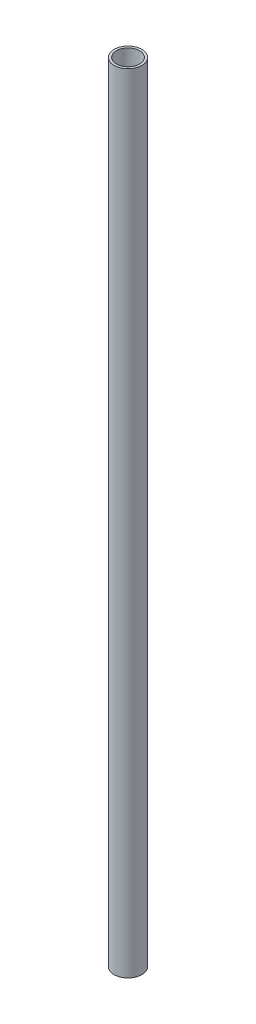
from build123d import *

# Parameters (mm, degrees)
SKETCH_1_R      = 6
SKETCH_1_R_2    = 5
EXTRUDE_1_DEPTH = 340


with BuildPart() as part:
    # 草图1 → 凸台-拉伸1 (new body)
    with BuildSketch(Plane(origin=(0, 0, 0), x_dir=(1, 0, 0), z_dir=(0, 1, 0))):
        Circle(SKETCH_1_R)
        Circle(SKETCH_1_R_2, mode=Mode.SUBTRACT)
    extrude(amount=EXTRUDE_1_DEPTH)


solid = part.part
